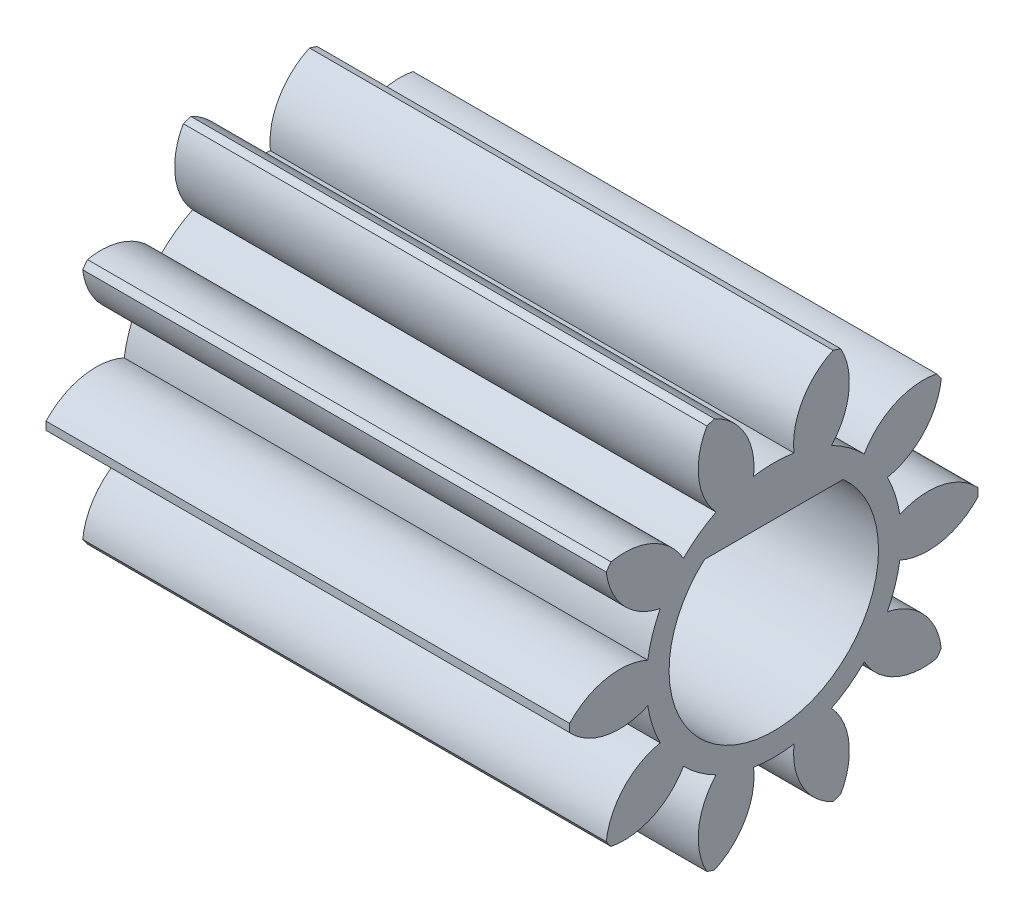
from build123d import *

# Parameters (mm, degrees)
BASPROSKE_W         = 10
BASPROSKE_H         = 3.9
TOOTHCUT_DEPTH      = 12.420157617
TEETHCUTS_COUNT     = 10
TEETHCUTS_ANGLE     = 324
BORSKE_R            = 2
BORE_DEPTH          = 50.0000508
BOSS_EXTRUDE1_DEPTH = 10


with BuildPart() as part:
    # BasProSke → Base-Revolve (revolve)
    with BuildSketch(Plane(origin=(0, 0, 0), x_dir=(1, 0, 0), z_dir=(0, 1, 0))):
        with Locations((5, 1.95)):
            Rectangle(BASPROSKE_W, BASPROSKE_H)
    revolve(axis=Axis((-10, 0, 0), (1, 0, 0)))

    # TooCutSke → ToothCut (cut, through all)
    with BuildSketch(Plane(origin=(0, 0, 0), x_dir=(0, 0, -1), z_dir=(1, 0, 0))):
        with BuildLine():
            ThreePointArc((0.385742456, 2.405771188), (0, 2.4365), (-0.385742456, 2.405771188))
            ThreePointArc((-0.385742456, 2.405771188), (-0.554137717, 3.206334653), (-1.167391562, 3.747794298))
            ThreePointArc((-1.167391562, 3.747794298), (0, 3.9254), (1.167391562, 3.747794298))
            ThreePointArc((1.167391562, 3.747794298), (0.554137717, 3.206334653), (0.385742456, 2.405771188))
        make_face()
    toothcut = extrude(amount=TOOTHCUT_DEPTH, mode=Mode.SUBTRACT)

    # TeethCuts: ToothCut ×10 about axis
    teethcuts_axis = Axis((-10, 0, 0), (1, 0, 0))
    for i in range(1, TEETHCUTS_COUNT):
        add(toothcut.rotate(teethcuts_axis, i * TEETHCUTS_ANGLE / (TEETHCUTS_COUNT - 1)), mode=Mode.SUBTRACT)

    # BorSke → Bore (cut, symmetric)
    with BuildSketch(Plane(origin=(0, 0, 0), x_dir=(0, 0, -1), z_dir=(1, 0, 0))):
        Circle(BORSKE_R)
    extrude(amount=BORE_DEPTH, both=True, mode=Mode.SUBTRACT)

    # Sketch1 → Boss-Extrude1 (add)
    with BuildSketch(Plane(origin=(10, 0, 0), x_dir=(0, 0, -1), z_dir=(1, 0, 0))):
        with BuildLine():
            Line((-1.322875656, 1.5), (1.322875656, 1.5))
            ThreePointArc((1.322875656, 1.5), (0, 2), (-1.322875656, 1.5))
        make_face()
    extrude(amount=-BOSS_EXTRUDE1_DEPTH)


solid = part.part
